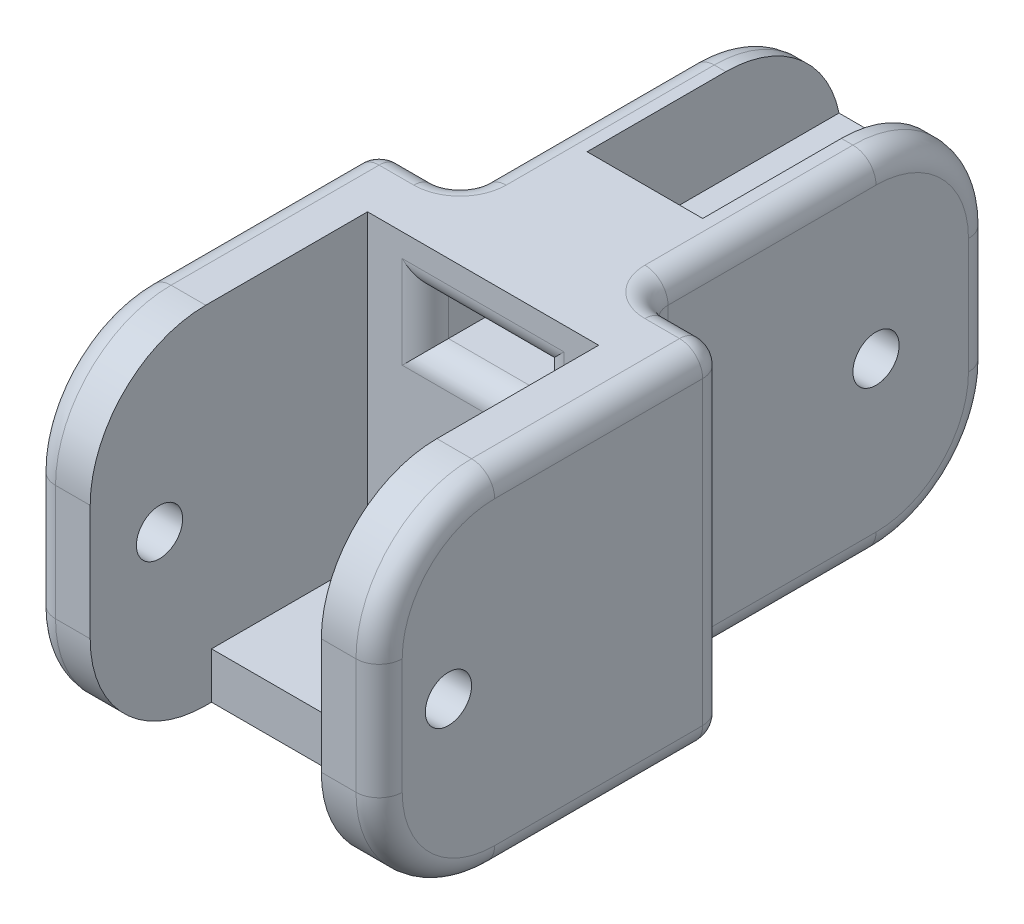
from build123d import *

# Parameters (mm, degrees)
BASE_SKETCH_W                    = 15
BASE_SKETCH_H                    = 15
BASE_SKETCH_EXTRUDE_DEPTH        = 30
CENTER_NUB_CUTOUT_SKETCH_W       = 3.5
CENTER_NUB_CUTOUT_SKETCH_H       = 15
HINGE_NUB_EXTRUDED_CUT_DEPTH     = 15
HINGE_CUTOUT_SKETCH_W            = 10
HINGE_CUTOUT_SKETCH_H            = 15
HINGE_CUTOUT_EXTRUDED_CUT_DEPTH  = 12
HINGE_HOLE_SKETCH_R              = 1
HINGE_HOLE_EXTRUDED_CUT_DEPTH    = 35.369317712
CORNER_FILLETS_R                 = 5
STYLE_FILLETS_R                  = 1
ROUTING_HOLES_SKETCH_W           = 5
ROUTING_HOLES_SKETCH_H           = 2
ROUTING_HOLES_EXTRUDED_CUT_DEPTH = 32.819805153
SKETCH1_W                        = 10
SKETCH1_H                        = 2
BACKING_EXTRUDE_DEPTH            = 6.75
EXTRA_ROUTING_CUT_SKETCH_W       = 5
EXTRA_ROUTING_CUT_SKETCH_H       = 10
EXTRA_ROUTING_EXTRUDED_CUT_DEPTH = 4
ROUTING_FILLETS_R                = 1


with BuildPart() as part:
    # Base Sketch → Base Sketch Extrude (new body)
    with BuildSketch(Plane.XY):
        Rectangle(BASE_SKETCH_W, BASE_SKETCH_H)
    extrude(amount=BASE_SKETCH_EXTRUDE_DEPTH)

    # Center Nub Cutout Sketch → Hinge Nub Extruded Cut (cut)
    with BuildSketch(Plane.XY):
        with Locations((5.75, 0)):
            Rectangle(CENTER_NUB_CUTOUT_SKETCH_W, CENTER_NUB_CUTOUT_SKETCH_H)
        with Locations((-5.75, 0)):
            Rectangle(CENTER_NUB_CUTOUT_SKETCH_W, CENTER_NUB_CUTOUT_SKETCH_H)
    extrude(amount=HINGE_NUB_EXTRUDED_CUT_DEPTH, mode=Mode.SUBTRACT)

    # Hinge Cutout Sketch → Hinge Cutout Extruded Cut (cut)
    with BuildSketch(Plane.XY.offset(30)):
        Rectangle(HINGE_CUTOUT_SKETCH_W, HINGE_CUTOUT_SKETCH_H)
    extrude(amount=-HINGE_CUTOUT_EXTRUDED_CUT_DEPTH, mode=Mode.SUBTRACT)

    # Hinge Hole Sketch → Hinge Hole Extruded Cut (cut, through all)
    with BuildSketch(Plane(origin=(7.5, 0, 0), x_dir=(0, 0, -1), z_dir=(1, 0, 0))):
        with Locations(Location((-5, 0, 0), (0, 0, 90))):
            Circle(HINGE_HOLE_SKETCH_R)
        with Locations(Location((-27, 0, 0), (0, 0, 90))):
            Circle(HINGE_HOLE_SKETCH_R)
    extrude(amount=-HINGE_HOLE_EXTRUDED_CUT_DEPTH, mode=Mode.SUBTRACT)

    # Corner Fillets
    corner_fillets_edges = [part.edges().sort_by_distance(p)[0] for p in [
        (0, -7.5, 0),
        (0, 7.5, 0),
        (-6.25, -7.5, 30),
        (-6.25, 7.5, 30),
        (6.25, -7.5, 30),
        (6.25, 7.5, 30),
    ]]
    fillet(corner_fillets_edges, radius=CORNER_FILLETS_R)

    # Style Fillets
    style_fillets_edges = [part.edges().sort_by_distance(p)[0] for p in [
        (4, 7.5, 10),
        (4, -7.5, 10),
        (7.5, 0, 15),
        (5.75, 7.5, 15),
        (4, 0, 15),
        (5.75, -7.5, 15),
        (-4, -7.5, 10),
        (-4, 7.5, 10),
        (-7.5, 0, 15),
        (-5.75, -7.5, 15),
        (-4, 0, 15),
        (-5.75, 7.5, 15),
        (-7.5, 0, 30),
        (-7.5, -7.5, 20),
        (7.5, -7.5, 20),
        (-7.5, 7.5, 20),
        (-7.5, 6.035533906, 28.535533906),
        (-7.5, -6.035533906, 28.535533906),
        (7.5, 7.5, 20),
        (7.5, 0, 30),
        (7.5, 6.035533906, 28.535533906),
        (7.5, -6.035533906, 28.535533906),
        (4, 0, 0),
        (4, 6.035533906, 1.464466094),
        (4, -6.035533906, 1.464466094),
        (-4, 0, 0),
        (-4, 6.035533906, 1.464466094),
        (-4, -6.035533906, 1.464466094),
    ]]
    fillet(style_fillets_edges, radius=STYLE_FILLETS_R)

    # Routing Holes Sketch → Routing Holes Extruded Cut (cut, through all)
    with BuildSketch(Plane.XY):
        with Locations((0, 4.5)):
            Rectangle(ROUTING_HOLES_SKETCH_W, ROUTING_HOLES_SKETCH_H)
        with Locations((0, -4.5)):
            Rectangle(ROUTING_HOLES_SKETCH_W, ROUTING_HOLES_SKETCH_H)
    extrude(amount=ROUTING_HOLES_EXTRUDED_CUT_DEPTH, mode=Mode.SUBTRACT)

    # Sketch1 → Backing Extrude (add)
    with BuildSketch(Plane.XY.offset(18)):
        with Locations((0, -6.5)):
            Rectangle(SKETCH1_W, SKETCH1_H)
    extrude(amount=BACKING_EXTRUDE_DEPTH)

    # Extra Routing Cut Sketch → Extra Routing Extruded Cut (cut)
    with BuildSketch(Plane(origin=(0, 7.5, 0), x_dir=(1, 0, 0), z_dir=(0, 1, 0))):
        with Locations((0, -6)):
            Rectangle(EXTRA_ROUTING_CUT_SKETCH_W, EXTRA_ROUTING_CUT_SKETCH_H)
    extrude(amount=-EXTRA_ROUTING_EXTRUDED_CUT_DEPTH, mode=Mode.SUBTRACT)

    # Routing Fillets
    routing_fillets_edges = [part.edges().sort_by_distance(p)[0] for p in [
        (0, -3.5, 0.101020514),
        (-2.5, 4.5, 18),
        (0, 3.5, 18),
        (2.5, 4.5, 18),
        (0, 5.5, 18),
        (2.5, -4.5, 18),
        (0, -3.5, 18),
        (-2.5, -4.5, 18),
        (0, 5.5, 11),
    ]]
    fillet(routing_fillets_edges, radius=ROUTING_FILLETS_R - 0.0001)  # a hair under: the kernel refuses the full size


solid = part.part
